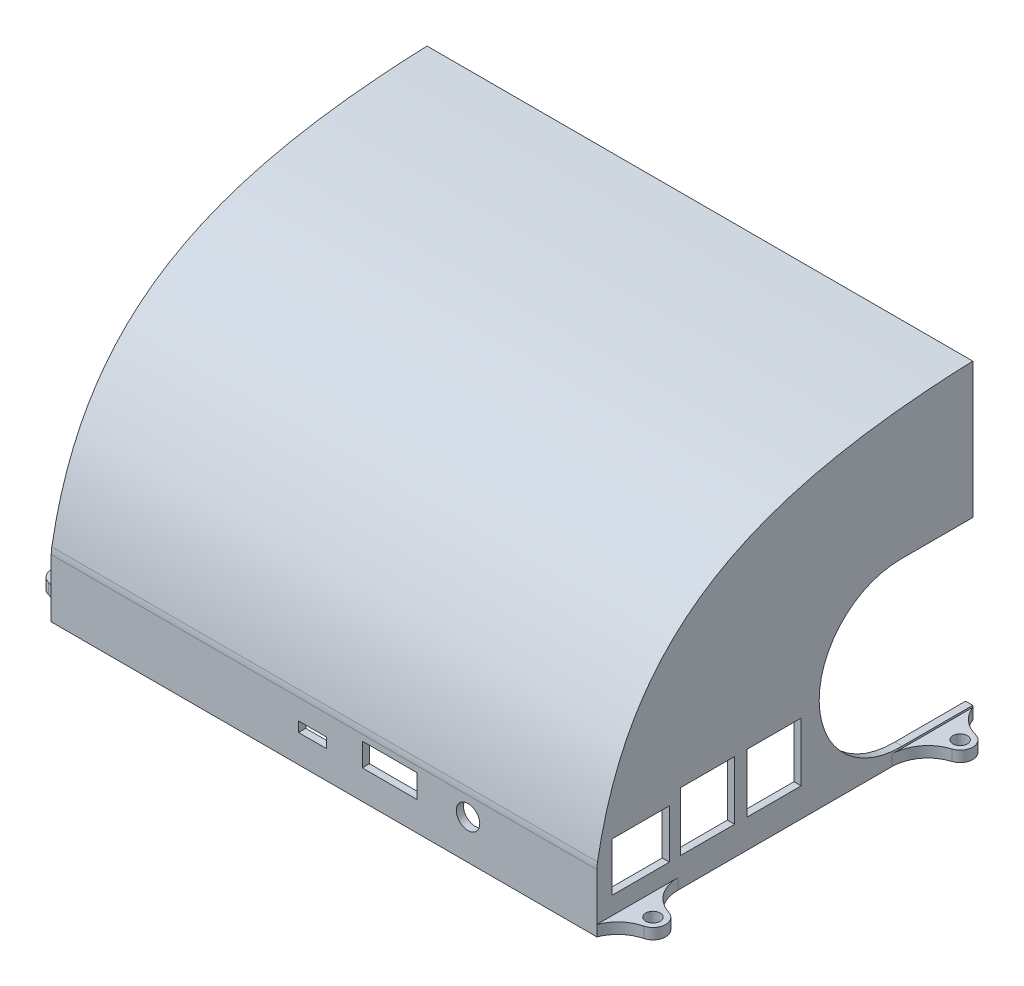
from build123d import *

# Parameters (mm, degrees)
SKETCH2_W           = 151
SKETCH2_H           = 104
BOSS_EXTRUDE1_DEPTH = 2
BOSS_EXTRUDE2_DEPTH = 151
SHELL1_T            = -2
SKETCH4_R           = 3.25
CUT_EXTRUDE1_DEPTH  = 10
SKETCH5_W           = 15
SKETCH5_H           = 16.25
CUT_EXTRUDE2_DEPTH  = 10
FILLET3_R           = 10
CUT_EXTRUDE3_DEPTH  = 10
SKETCH7_R           = 2
BOSS_EXTRUDE3_DEPTH = 3
FILLET4_DEPTH       = 3
FILLET5_R           = 10
SKETCH9_W           = 147
SKETCH9_H           = 102
CUT_EXTRUDE5_DEPTH  = 10


with BuildPart() as part:
    # Sketch2 → Boss-Extrude1 (new body)
    with BuildSketch(Plane(origin=(0, 0, 0), x_dir=(1, 0, 0), z_dir=(0, 1, 0))):
        with Locations((0, -52)):
            Rectangle(SKETCH2_W, SKETCH2_H)
    extrude(amount=BOSS_EXTRUDE1_DEPTH)

    # Sketch3 → Boss-Extrude2 (add)
    with BuildSketch(Plane.ZY.offset(75.5)):
        with BuildLine():
            Line((0, 86), (0, 2))
            Line((0, 2), (104, 2))
            Line((104, 2), (104, 17))
            add(Edge.make_bspline(
                [(0, 86), (63.599399009, 83.650763879), (95.616153821, 65.97970086), (104, 17)],
                knots=[0, 0, 0, 0, 1, 1, 1, 1], degree=3))
        make_face()
    extrude(amount=-BOSS_EXTRUDE2_DEPTH)

    # Shell1
    shell1_openings = [part.faces().sort_by_distance(p)[0] for p in [
        (0, 43, 0),
    ]]
    offset(amount=SHELL1_T, openings=shell1_openings, kind=Kind.INTERSECTION)

    # Sketch4 → Cut-Extrude1 (cut)
    with BuildSketch(Plane.XY.offset(104)):
        with Locations((39.832226511, 10.9)):
            Circle(SKETCH4_R)
        Polygon((-7.059283816, 10.485810058), (-7.059283816, 7.709546788), (-6.933696011, 7.709546788), (0.586748493, 7.709546788), (0.712336299, 7.709546788), (0.712336299, 10.485810058), (0.586748493, 10.485810058), (-0.123473759, 10.485810058), (-6.223473759, 10.485810058), (-6.933696011, 10.485810058), align=None)
        Polygon((12.260960064, 8.05), (14.595960064, 8.05), (25.670959902, 8.05), (25.770960048, 8.05), (25.770960048, 14.466884605), (25.670960048, 14.466884605), (10.670959945, 14.466884605), (10.570959945, 14.466884605), (10.570959945, 8.05), (10.670960001, 8.05), align=None)
    extrude(amount=-CUT_EXTRUDE1_DEPTH, mode=Mode.SUBTRACT)

    # Sketch5 → Cut-Extrude2 (cut)
    with BuildSketch(Plane(origin=(75.5, 0, 0), x_dir=(0, 0, -1), z_dir=(1, 0, 0))):
        Polygon((-99.83530855, 21.4), (-99.83530855, 7.899), (-83.93530855, 7.899), (-83.93530855, 21.4), (-99.53530855, 21.4), align=None)
        Polygon((-65.884309216, 7.95), (-80.884309216, 7.95), (-80.884309216, 21.65), (-80.884309216, 24.2), (-78.334309216, 24.2), (-65.884309216, 24.2), align=None)
        with Locations((-54.984309216, 16.075)):
            Rectangle(SKETCH5_W, SKETCH5_H)
    extrude(amount=-CUT_EXTRUDE2_DEPTH, mode=Mode.SUBTRACT)

    # Fillet3
    fillet3_edges = [part.edges().sort_by_distance(p)[0] for p in [
        (0, 17, 104),
    ]]
    fillet(fillet3_edges, radius=FILLET3_R)

    # Sketch6 → Cut-Extrude3 (cut)
    with BuildSketch(Plane(origin=(75.5, 0, 0), x_dir=(0, 0, -1), z_dir=(1, 0, 0))):
        with BuildLine():
            Line((-20, 48.5), (0, 48.5))
            Line((0, 48.5), (0, 3.504835596))
            Line((0, 3.504835596), (-19.533546963, 3.504835596))
            ThreePointArc((-19.533546963, 3.504835596), (-42.498791069, 25.766760949), (-20, 48.5))
        make_face()
    extrude(amount=-CUT_EXTRUDE3_DEPTH, mode=Mode.SUBTRACT)

    # Sketch7 → Boss-Extrude3 (add)
    # profile 1 of 4: a face of its own
    with BuildSketch(Plane.XZ):
        with BuildLine():
            Line((75.5, 98), (75.5, 91))
            Line((75.5, 91), (81.5, 91))
            ThreePointArc((81.5, 91), (85, 94.5), (81.5, 98))
            Line((81.5, 98), (75.5, 98))
        make_face()
        with Locations(Location((81.5, 94.5, 0), (0, 0, 270))):
            Circle(SKETCH7_R, mode=Mode.SUBTRACT)
    # profile 2 of 4: a face of its own
    with BuildSketch(Plane.XZ):
        with BuildLine():
            Line((-81.5, 91), (-75.5, 91))
            Line((-75.5, 91), (-75.5, 98))
            Line((-75.5, 98), (-81.5, 98))
            ThreePointArc((-81.5, 98), (-85, 94.5), (-81.5, 91))
        make_face()
        with Locations(Location((-81.5, 94.5, 0), (0, 0, 90))):
            Circle(SKETCH7_R, mode=Mode.SUBTRACT)
    # profile 3 of 4: a face of its own
    with BuildSketch(Plane.XZ):
        with BuildLine():
            Line((-75.5, 6), (-75.5, 13))
            Line((-75.5, 13), (-81.5, 13))
            ThreePointArc((-81.5, 13), (-85, 9.5), (-81.5, 6))
            Line((-81.5, 6), (-75.5, 6))
        make_face()
        with Locations(Location((-81.5, 9.5, 0), (0, 0, 270))):
            Circle(SKETCH7_R, mode=Mode.SUBTRACT)
    # profile 4 of 4: a face of its own
    with BuildSketch(Plane.XZ):
        with BuildLine():
            Line((81.5, 13), (75.5, 13))
            Line((75.5, 13), (75.5, 6))
            Line((75.5, 6), (81.5, 6))
            ThreePointArc((81.5, 6), (85, 9.5), (81.5, 13))
        make_face()
        with Locations(Location((81.5, 9.5, 0), (0, 0, 90))):
            Circle(SKETCH7_R, mode=Mode.SUBTRACT)
    extrude(amount=-BOSS_EXTRUDE3_DEPTH)

    # Fillet4: read off the stored shape, not the designer's step
    # Fillet4 outline → Fillet4 (add)
    with BuildSketch(Plane(origin=(0, 0, 0), x_dir=(1, 0, 0), z_dir=(0, 1, 0))):
        with BuildLine():
            ThreePointArc((-81.5, -13), (-82.024439287, -12.960486011), (-82.537037037, -12.842836248))
            ThreePointArc((-82.537037037, -12.842836248), (-77.449235141, -16.462086818), (-75.5, -22.393796958))
            Line((-75.5, -22.393796958), (-75.5, -13))
            Line((-75.5, -13), (-81.5, -13))
        make_face()
        with BuildLine():
            ThreePointArc((-75.5, 0), (-78.189320969, -3.889565288), (-82.365092102, -6.108596801))
            ThreePointArc((-82.365092102, -6.108596801), (-81.935940825, -6.027255322), (-81.5, -6))
            Line((-81.5, -6), (-75.5, -6))
            Line((-75.5, -6), (-75.5, 0))
        make_face()
    extrude(amount=FILLET4_DEPTH)

    # Fillet5
    # the kernel refuses this fillet: 10 mm, written as the material it adds along each edge
    with BuildSketch(Plane(origin=(75.5, 0, 13), x_dir=(0, 0, 1), z_dir=(0, 1, 0)), Plane(origin=(-75.5, 0, 91), x_dir=(0, 0, -1), z_dir=(0, 1, 0))) as fillet5_piece_1:
        with BuildLine():
            CenterArc((9.393796958, 10), FILLET5_R, 197.235285257, 72.764714743)
            Line((-0.157163752, 7.037037037), (-1.112259823, 6.740740741))
            ThreePointArc((-1.112259823, 6.740740741), (-1, 6), (-1, 0))
            Line((-1, 0), (0, -1))
            Line((0, -1), (9.393796958, -1))
            Line((9.393796958, -1), (9.393796958, 0))
        make_face()
    extrude(amount=3)
    with BuildSketch(Plane(origin=(75.5, 0, 6), x_dir=(0, 0, -1), z_dir=(0, 1, 0)), Plane(origin=(-75.5, 0, 98), x_dir=(0, 0, 1), z_dir=(0, 1, 0))) as fillet5_piece_2:
        with BuildLine():
            CenterArc((9.581126623, -9.33678382), FILLET5_R, 110.984333313, 54.705605323)
            Line((-0.108596801, -6.865092102), (-1.077569144, -6.61792293))
            ThreePointArc((-1.077569144, -6.61792293), (-1, -6), (-1, 0))
            Line((-1, 0), (0, 1))
            ThreePointArc((0, 1), (3, 1), (5.641887338, 0.933678382))
            Line((5.641887338, 0.933678382), (6, 0))
        make_face()
    extrude(amount=3)
    with BuildSketch(Plane(origin=(75.5, 0, 91), x_dir=(0, 0, -1), z_dir=(0, 1, 0))) as fillet5_piece_3:
        with BuildLine():
            CenterArc((9.393796958, -10), FILLET5_R, 90, 72.764714743)
            Line((-0.157163752, -7.037037037), (-1.112259823, -6.740740741))
            ThreePointArc((-1.112259823, -6.740740741), (-1, -6), (-1, 0))
            Line((-1, 0), (0, 1))
            Line((0, 1), (9.393796958, 1))
            Line((9.393796958, 1), (9.393796958, 0))
        make_face()
    extrude(amount=3)
    with BuildSketch(Plane(origin=(75.5, 0, 98), x_dir=(0, 0, 1), z_dir=(0, 1, 0))) as fillet5_piece_4:
        with BuildLine():
            CenterArc((9.581126623, 9.33678382), FILLET5_R, 194.310061364, 54.705605323)
            Line((-0.108596801, 6.865092102), (-1.077569144, 6.61792293))
            ThreePointArc((-1.077569144, 6.61792293), (-1, 6), (-1, 0))
            Line((-1, 0), (0, -1))
            ThreePointArc((0, -1), (3, -1), (5.641887338, -0.933678382))
            Line((5.641887338, -0.933678382), (6, 0))
        make_face()
    extrude(amount=3)

    # Sketch9 → Cut-Extrude5 (cut)
    with BuildSketch(Plane(origin=(0, 2, 0), x_dir=(1, 0, 0), z_dir=(0, 1, 0))):
        with Locations((0, -51)):
            Rectangle(SKETCH9_W, SKETCH9_H)
    extrude(amount=-CUT_EXTRUDE5_DEPTH, mode=Mode.SUBTRACT)


solid = part.part
